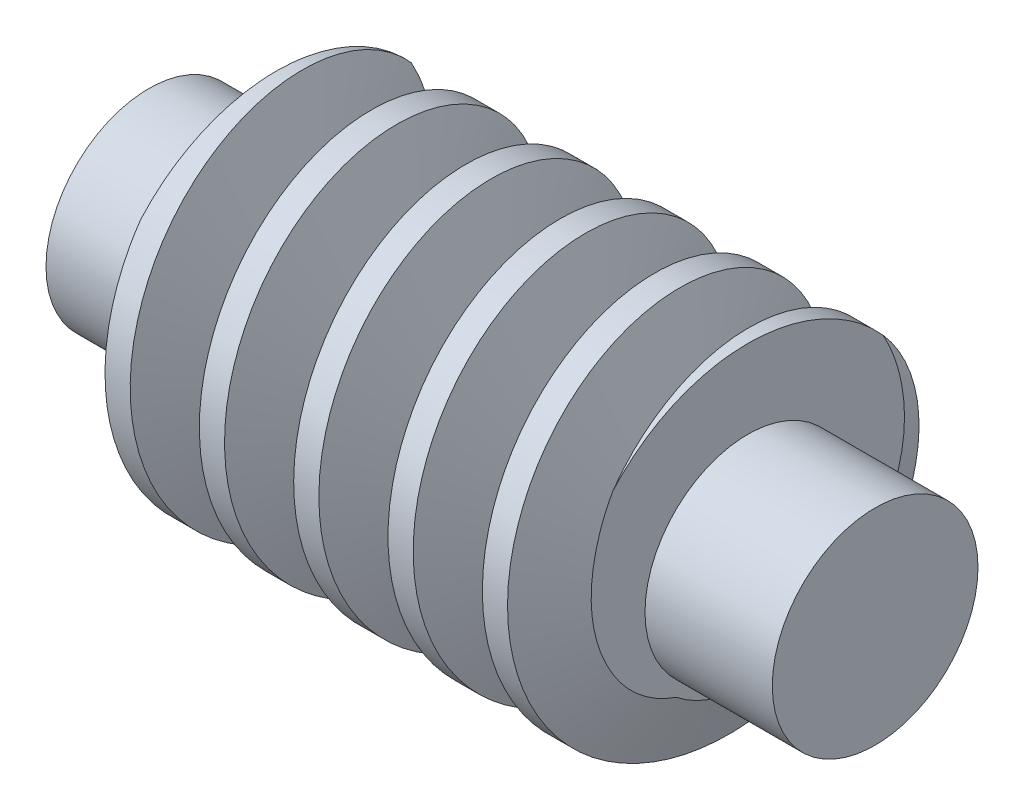
from build123d import *

# Parameters (mm, degrees)
ESQUISSE1_W        = 11.04934514
ESQUISSE1_H        = 2.677031978
BALAYAGE2_PITCH    = 2.209869028
ESQUISSE2_R        = 2.40932878
BOSS_EXTRU_1_DEPTH = 2.982213624


with BuildPart() as part:
    # Esquisse1 → Révolution1 (revolve)
    with BuildSketch(Plane.XY, mode=Mode.PRIVATE) as r_volution1_sk:
        with Locations((0, 1.338515989)):
            Rectangle(ESQUISSE1_W, ESQUISSE1_H)
    revolve(r_volution1_sk.sketch.rotate(Axis((-39.34140866, 0, 0), (1, 0, 0)), 90), axis=Axis((-39.34140866, 0, 0), (1, 0, 0)))

    # Balayage2: the profile of Esquisse5 profile screwed along a right-hand helix of 6.5 turns, 10 arcs to a turn; built about Z, then put on its axis
    balayage2_z = Axis((0, 0, 0), (0, 0, 1))
    balayage2_corners = [(4.252031978, 0, 0.29499955), (2.676731978, 0, 0.86836186), (2.676731978, 0, -0.86836186), (4.252031978, 0, -0.29499955)]
    with BuildLine(mode=Mode.PRIVATE) as balayage2_profile:
        Line(balayage2_corners[0], balayage2_corners[1])
        Line(balayage2_corners[1], balayage2_corners[2])
        Line(balayage2_corners[2], balayage2_corners[3])
        Line(balayage2_corners[3], balayage2_corners[0])
    balayage2_cap = Face(balayage2_profile.wire())
    balayage2_turn_angles = [0, 18, 36, 54, 72, 90, 108, 126, 144, 162, 180, 198, 216, 234, 252, 270, 288, 306, 324, 342, 360]
    balayage2_turn_weights = [1, 0.9510565162951535, 1, 0.9510565162951535, 1, 0.9510565162951535, 1, 0.9510565162951535, 1, 0.9510565162951535, 1, 0.9510565162951535, 1, 0.9510565162951535, 1, 0.9510565162951535, 1, 0.9510565162951535, 1, 0.9510565162951535, 1]
    balayage2_turn_rails = [Edge.make_bspline([Vector(p[0], p[1], 0).rotate(balayage2_z, balayage2_turn_angles[k]) / balayage2_turn_weights[k] + Vector(0, 0, p[2] + BALAYAGE2_PITCH * balayage2_turn_angles[k] / 360) for k in range(21)], [0, 0, 0, 1, 1, 2, 2, 3, 3, 4, 4, 5, 5, 6, 6, 7, 7, 8, 8, 9, 9, 10, 10, 10], 2, balayage2_turn_weights) for p in balayage2_corners]
    balayage2_turn_sides = [Face.make_surface_from_curves(balayage2_turn_rails[p[0]], balayage2_turn_rails[p[1]]) for p in [(0, 1), (1, 2), (2, 3), (3, 0)]]
    balayage2_last_angles = [2160, 2178, 2196, 2214, 2232, 2250, 2268, 2286, 2304, 2322, 2340]
    balayage2_last_weights = [1, 0.9510565162951535, 1, 0.9510565162951535, 1, 0.9510565162951535, 1, 0.9510565162951535, 1, 0.9510565162951438, 1]
    balayage2_last_rails = [Edge.make_bspline([Vector(p[0], p[1], 0).rotate(balayage2_z, balayage2_last_angles[k]) / balayage2_last_weights[k] + Vector(0, 0, p[2] + BALAYAGE2_PITCH * balayage2_last_angles[k] / 360) for k in range(11)], [0, 0, 0, 1, 1, 2, 2, 3, 3, 4, 4, 5, 5, 5], 2, balayage2_last_weights) for p in balayage2_corners]
    balayage2_last_sides = [Face.make_surface_from_curves(balayage2_last_rails[p[0]], balayage2_last_rails[p[1]]) for p in [(0, 1), (1, 2), (2, 3), (3, 0)]]
    balayage2 = Plane(origin=(7.734541598, 0, 0), x_dir=(0, 1, 0), z_dir=(-1, 0, 0)) * Solid(Shell([*[p.moved(Location((0, 0, BALAYAGE2_PITCH * i))) for i in range(6) for p in balayage2_turn_sides], *balayage2_last_sides, balayage2_cap, balayage2_cap.rotate(balayage2_z, 2340).moved(Location((0, 0, BALAYAGE2_PITCH * 2340 / 360)))]))
    add(balayage2)

    # Enlèv. mat.-Surface1
    split(bisect_by=Plane(origin=(5.52467257, 0, 0), x_dir=(0, 0, -1), z_dir=(1, 0, 0)), keep=Keep.BOTTOM)

    # Enlèv. mat.-Surface2
    split(bisect_by=Plane.ZY.offset(5.52467257), keep=Keep.BOTTOM)

    # Esquisse2 → Boss.-Extru.1 (add)
    with BuildSketch(Plane(origin=(5.52467257, 0, 0), x_dir=(0, 0, -1), z_dir=(1, 0, 0))):
        with Locations(Location((0, 0, 0), (0, 0, 180))):
            Circle(ESQUISSE2_R)
    boss_extru_1 = extrude(amount=BOSS_EXTRU_1_DEPTH)

    # Symétrie1: Boss.-Extru.1 across plane
    add(boss_extru_1.mirror(Plane(origin=(0, 0, 0), x_dir=(0, 0, 1), z_dir=(1, 0, 0))))


solid = part.part
